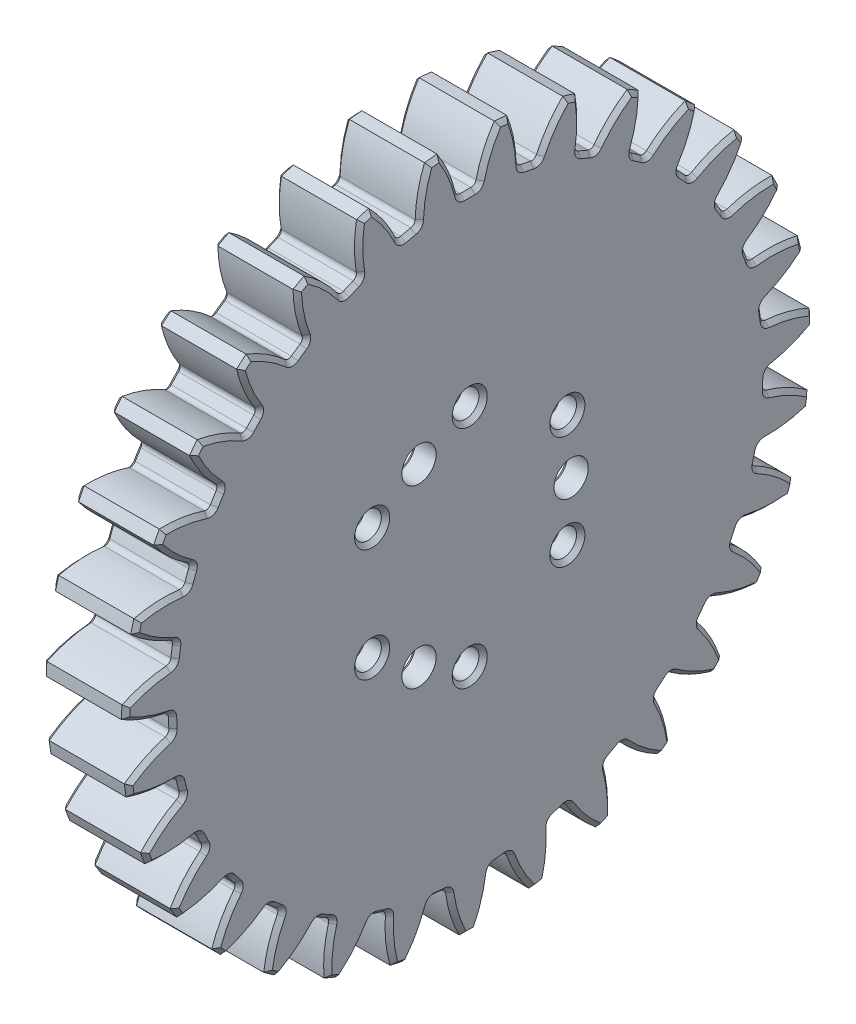
from build123d import *

# Parameters (mm, degrees)
BASPROSKE_W                = 10
BASPROSKE_H                = 41.25
TOOTHCUT_DEPTH             = 60.187203009
ROOTFILLETS_R              = 0.626
TEETHCUTS_COUNT            = 31
TEETHCUTS_ANGLE            = 348.387096774
ROOTFILLETS_OF_TEETHCUTS_R = 0.626
BORSKE_R                   = 25
BORE_DEPTH                 = 50.0000508
SKETCH_3_R                 = 25
SKETCH_3_R_2               = 24.65
EXTRUDE_1_DEPTH            = 10
SKETCH_4_R                 = 24.65
EXTRUDE_2_DEPTH            = 3
SKETCH_6_R                 = 29.5
CUT_EXTRUDE_4_DEPTH        = 7
SKETCH_5_R                 = 1.6
CUT_EXTRUDE_3_DEPTH        = 59.739545682
CHAMFER_1_SIZE             = 0.5
SKETCH_7_R                 = 2.05
CUT_EXTRUDE_5_DEPTH        = 59.739545612
CHAMFER_2_SIZE             = 0.5


with BuildPart() as part:
    # BasProSke → Base-Revolve (revolve)
    with BuildSketch(Plane(origin=(0, 0, 0), x_dir=(1, 0, 0), z_dir=(0, 1, 0)), mode=Mode.PRIVATE) as base_revolve_sk:
        with Locations((5, 20.625)):
            Rectangle(BASPROSKE_W, BASPROSKE_H)
    revolve(base_revolve_sk.sketch.rotate(Axis((-10, 0, 0), (1, 0, 0)), 180), axis=Axis((-10, 0, 0), (1, 0, 0)))

    # TooCutSke → ToothCut (cut, through all)
    with BuildSketch(Plane(origin=(0, 0, 0), x_dir=(0, 0, -1), z_dir=(1, 0, 0))):
        with BuildLine():
            ThreePointArc((1.147808078, 35.605503965), (0, 35.624), (-1.147808078, 35.605503965))
            ThreePointArc((-1.147808078, 35.605503965), (-2.025088466, 38.480305856), (-3.440714783, 41.131741112))
            ThreePointArc((-3.440714783, 41.131741112), (0, 41.2754), (3.440714783, 41.131741112))
            ThreePointArc((3.440714783, 41.131741112), (2.025088466, 38.480305856), (1.147808078, 35.605503965))
        make_face()
    toothcut = extrude(amount=TOOTHCUT_DEPTH, mode=Mode.SUBTRACT)

    # RootFillets
    rootfillets_edges = [part.edges().sort_by_distance(p)[0] for p in [
        (5, 35.605503965, -1.147808078),
        (5, 35.605503965, 1.147808078),
    ]]
    fillet(rootfillets_edges, radius=ROOTFILLETS_R)

    # TeethCuts: ToothCut ×31 about axis
    teethcuts_axis = Axis((-10, 0, 0), (1, 0, 0))
    for i in range(1, TEETHCUTS_COUNT):
        add(toothcut.rotate(teethcuts_axis, i * TEETHCUTS_ANGLE / (TEETHCUTS_COUNT - 1)), mode=Mode.SUBTRACT)

    # RootFillets of TeethCuts
    rootfillets_of_teethcuts_edges = [part.edges().sort_by_distance(p)[0] for p in [
        (5, 35.107709275, 6.043022876),
        (5, 34.64560514, 8.291647635),
        (5, 33.172600842, 12.986451763),
        (5, 32.267311169, 15.096026163),
        (5, 29.879402233, 19.398213789),
        (5, 28.567989688, 21.282371606),
        (5, 25.362937385, 25.015810664),
        (5, 23.699091353, 26.597414255),
        (5, 19.808110902, 29.609257311),
        (5, 17.859949433, 30.82355564),
        (5, 13.44233803, 32.990497485),
        (5, 11.289619084, 33.787777034),
        (5, 6.52623426, 35.021102815),
        (5, 4.257090404, 35.368722868),
        (5, -0.657054307, 35.617940081),
        (5, -2.949724057, 35.501669031),
        (5, -7.813442994, 34.756574696),
        (5, -10.035776469, 34.181172693),
        (5, -14.649948406, 32.472271059),
        (5, -16.710963013, 31.461295129),
        (5, -20.88668321, 28.858548829),
        (5, -22.702000768, 27.453388445),
        (5, -26.268314748, 24.063354219),
        (5, -27.763615944, 22.321536814),
        (5, -30.574518395, 18.283003061),
        (5, -31.688585421, 16.275838842),
        (5, -33.628997666, 11.754143609),
        (5, -34.316220488, 9.563806116),
        (5, -35.306701822, 4.744068136),
        (5, -35.538945456, 2.460230043),
        (5, -35.538945456, -2.460230043),
        (5, -35.306701822, -4.744068136),
        (5, -34.316220488, -9.563806116),
        (5, -33.628997666, -11.754143609),
        (5, -31.688585421, -16.275838842),
        (5, -30.574518395, -18.283003061),
        (5, -27.763615944, -22.321536814),
        (5, -26.268314748, -24.063354219),
        (5, -22.702000768, -27.453388445),
        (5, -20.88668321, -28.858548829),
        (5, -16.710963013, -31.461295129),
        (5, -14.649948406, -32.472271059),
        (5, -10.035776469, -34.181172693),
        (5, -7.813442994, -34.756574696),
        (5, -2.949724057, -35.501669031),
        (5, -0.657054307, -35.617940081),
        (5, 4.257090404, -35.368722868),
        (5, 6.52623426, -35.021102815),
        (5, 11.289619084, -33.787777034),
        (5, 13.44233803, -32.990497485),
        (5, 17.859949433, -30.82355564),
        (5, 19.808110902, -29.609257311),
        (5, 23.699091353, -26.597414255),
        (5, 25.362937385, -25.015810664),
        (5, 28.567989688, -21.282371606),
        (5, 29.879402233, -19.398213789),
        (5, 32.267311169, -15.096026163),
        (5, 33.172600842, -12.986451763),
        (5, 34.64560514, -8.291647635),
        (5, 35.107709275, -6.043022876),
    ]]
    fillet(rootfillets_of_teethcuts_edges, radius=ROOTFILLETS_OF_TEETHCUTS_R)

    # BorSke → Bore (cut, symmetric)
    with BuildSketch(Plane(origin=(0, 0, 0), x_dir=(0, 0, -1), z_dir=(1, 0, 0))):
        with Locations(Location((0, 0, 0), (0, 0, 180))):
            Circle(BORSKE_R)
    extrude(amount=BORE_DEPTH, both=True, mode=Mode.SUBTRACT)

    # 草图3 → 凸台-拉伸1 (add)
    with BuildSketch(Plane(origin=(10, 0, 0), x_dir=(0, 0, -1), z_dir=(1, 0, 0))):
        Circle(SKETCH_3_R)
        Circle(SKETCH_3_R_2, mode=Mode.SUBTRACT)
    extrude(amount=-EXTRUDE_1_DEPTH)

    # 草图4 → 凸台-拉伸2 (add)
    with BuildSketch(Plane(origin=(10, 0, 0), x_dir=(0, 0, -1), z_dir=(1, 0, 0))):
        Circle(SKETCH_4_R)
    extrude(amount=-EXTRUDE_2_DEPTH)

    # 草图6 → 切除-拉伸4 (cut)
    with BuildSketch(Plane.ZY):
        Circle(SKETCH_6_R)
    extrude(amount=-CUT_EXTRUDE_4_DEPTH, mode=Mode.SUBTRACT)

    # 草图5 → 切除-拉伸3 (cut, through all)
    with BuildSketch(Plane.ZY.offset(-7)):
        with Locations((0, 13.5)):
            Circle(SKETCH_5_R)
        with Locations((11.691342951, 6.75)):
            Circle(SKETCH_5_R)
        with Locations((11.691342951, -6.75)):
            Circle(SKETCH_5_R)
        with Locations((0, -13.5)):
            Circle(SKETCH_5_R)
        with Locations((-11.691342951, -6.75)):
            Circle(SKETCH_5_R)
        with Locations((-11.691342951, 6.75)):
            Circle(SKETCH_5_R)
    extrude(amount=-CUT_EXTRUDE_3_DEPTH, mode=Mode.SUBTRACT)

    # 倒角1
    chamfer_1_edges = [part.edges().sort_by_distance(p)[0] for p in [
        (0, 29.23887683, -20.350858895),
        (10, 29.23887683, -20.350858895),
        (0, 30.553578018, -23.846825759),
        (10, 30.553578018, -23.846825759),
        (0, 32.973829839, -20.369555082),
        (0, 28.75327951, -21.268959503),
        (10, 28.75327951, -21.268959503),
        (0, 29.931177133, -19.576627809),
        (10, 29.931177133, -19.576627809),
        (0, 32.736953081, -14.048532983),
        (10, 32.736953081, -14.048532983),
        (0, 34.728475215, -17.208289796),
        (10, 34.728475215, -17.208289796),
        (0, 36.399214898, -13.315005944),
        (0, 32.446108261, -15.045590039),
        (10, 32.446108261, -15.045590039),
        (0, 33.259230385, -13.150791426),
        (10, 33.259230385, -13.150791426),
        (0, 34.894774627, -7.17105848),
        (10, 34.894774627, -7.17105848),
        (0, 37.481584557, -9.865244427),
        (10, 37.481584557, -9.865244427),
        (0, 38.334411822, -5.715338899),
        (0, 34.810589527, -8.206252352),
        (10, 34.810589527, -8.206252352),
        (0, 35.225646837, -6.186560097),
        (10, 35.225646837, -6.186560097),
        (0, 0, -29.5),
        (10, 13.5, -1.6),
        (10, 6.75, -13.291342951),
        (10, -6.75, -13.291342951),
        (10, -13.5, -1.6),
        (10, -6.75, 10.091342951),
        (10, 6.75, 10.091342951),
        (10, 41.03835959, -4.173193282),
        (10, 39.358244327, -12.348728823),
        (10, 36.066797916, -20.018705954),
        (10, 31.298772561, -26.869114912),
        (10, 25.24937178, -32.619499149),
        (10, 18.166258752, -37.034437257),
        (10, 10.339416956, -39.933181153),
        (10, 2.089278215, -41.197055921),
        (10, -6.246395822, -40.774318379),
        (10, -14.32634168, -38.682275451),
        (10, -21.819765426, -35.006575622),
        (10, -28.419885412, -29.897702473),
        (10, -33.85649195, -23.564813873),
        (10, -37.907009729, -16.267179023),
        (10, -40.405610077, -8.303563954),
        (10, -41.25, 0),
        (10, -40.405610077, 8.303563954),
        (10, -37.907009729, 16.267179023),
        (10, -33.85649195, 23.564813873),
        (10, -28.419885412, 29.897702473),
        (10, -21.819765426, 35.006575622),
        (10, -14.32634168, 38.682275451),
        (10, -6.246395822, 40.774318379),
        (10, 2.089278215, 41.197055921),
        (10, 10.339416956, 39.933181153),
        (10, 18.166258752, 37.034437257),
        (10, 25.24937178, 32.619499149),
        (10, 31.298772561, 26.869114912),
        (10, 36.066797916, 20.018705954),
        (10, 39.358244327, 12.348728823),
        (10, 38.700193422, 2.118314792),
        (10, -4.075728581, 38.543231118),
        (10, 3.766397206, 38.574687045),
        (10, 11.454326249, 37.026890751),
        (10, 18.673313829, 33.9632092),
        (10, 30.553578018, 23.846825759),
        (10, 25.127813747, 29.509069873),
        (10, 34.728475215, 17.208289796),
        (10, -38.715941598, 1.807787225),
        (10, -37.559519106, 9.564243462),
        (0, 35.624, 0),
        (10, 35.624, 0),
        (10, -30.743898075, 23.600952516),
        (10, -34.865405489, 16.929138448),
        (0, 38.700193422, -2.118314792),
        (10, 38.700193422, -2.118314792),
        (10, -18.945171484, 33.812315891),
        (10, -25.363731861, 29.306540816),
        (0, 38.700193422, 2.118314792),
        (10, -11.750993561, 36.933810781),
        (0, 35.749921169, -1.030949729),
        (10, 35.749921169, -1.030949729),
        (10, -22.013507979, -31.899807131),
        (0, 35.749921169, 1.030949729),
        (10, 35.749921169, 1.030949729),
        (10, -27.984274144, -26.815529627),
        (10, -15.141506211, -35.678102783),
        (10, -7.649609399, -37.995732715),
        (10, -32.809360837, -20.633421189),
        (10, -36.291228443, -13.606578063),
        (10, -38.287328892, -6.022680033),
        (10, 38.334411822, -5.715338899),
        (10, 36.399214898, -13.315005944),
        (0, 41.03835959, 4.173193282),
        (10, 28.198492312, -26.590172241),
        (10, 32.973829839, -20.369555082),
        (10, 22.268705197, -31.722184624),
        (10, 41.03835959, 4.173193282),
        (10, 15.427234675, -35.555487042),
        (10, 7.954171352, -37.933143642),
        (10, 0.15546332, -38.757812885),
        (10, 37.481584557, 9.865244427),
        (0, 39.358244327, -12.348728823),
        (0, 36.066797916, -20.018705954),
        (0, 34.894774627, 7.17105848),
        (10, 34.894774627, 7.17105848),
        (0, 31.298772561, -26.869114912),
        (0, 38.334411822, 5.715338899),
        (10, 38.334411822, 5.715338899),
        (0, 37.481584557, 9.865244427),
        (0, 35.225646837, 6.186560097),
        (10, 35.225646837, 6.186560097),
        (0, 25.24937178, -32.619499149),
        (0, 34.810589527, 8.206252352),
        (10, 34.810589527, 8.206252352),
        (0, 18.166258752, -37.034437257),
        (0, 32.736953081, 14.048532983),
        (10, 32.736953081, 14.048532983),
        (0, 36.399214898, 13.315005944),
        (10, 36.399214898, 13.315005944),
        (0, 10.339416956, -39.933181153),
        (0, 34.728475215, 17.208289796),
        (0, 33.259230385, 13.150791426),
        (10, 33.259230385, 13.150791426),
        (0, 32.446108261, 15.045590039),
        (10, 32.446108261, 15.045590039),
        (0, 2.089278215, -41.197055921),
        (0, 29.23887683, 20.350858895),
        (10, 29.23887683, 20.350858895),
        (0, -6.246395822, -40.774318379),
        (0, 32.973829839, 20.369555082),
        (10, 32.973829839, 20.369555082),
        (0, 30.553578018, 23.846825759),
        (0, 29.931177133, 19.576627809),
        (10, 29.931177133, 19.576627809),
        (0, 28.75327951, 21.268959503),
        (10, 28.75327951, 21.268959503),
        (0, -14.32634168, -38.682275451),
        (0, 24.543757525, 25.820018252),
        (0, -21.819765426, -35.006575622),
        (10, 24.543757525, 25.820018252),
        (0, 28.198492312, 26.590172241),
        (10, 28.198492312, 26.590172241),
        (0, 25.127813747, 29.509069873),
        (0, 25.377737972, 25.200994749),
        (0, -28.419885412, -29.897702473),
        (10, 25.377737972, 25.200994749),
        (0, 23.883288117, 26.621575265),
        (10, 23.883288117, 26.621575265),
        (0, -33.85649195, -23.564813873),
        (0, 18.843813904, 30.232103029),
        (10, 18.843813904, 30.232103029),
        (0, 22.268705197, 31.722184624),
        (10, 22.268705197, 31.722184624),
        (0, -37.907009729, -16.267179023),
        (0, 18.673313829, 33.9632092),
        (0, 19.785331237, 29.793630003),
        (10, 19.785331237, 29.793630003),
        (0, 18.035512103, 30.884300609),
        (10, 18.035512103, 30.884300609),
        (0, -40.405610077, -8.303563954),
        (0, 12.372402327, 33.406481956),
        (10, 12.372402327, 33.406481956),
        (0, -41.25, 0),
        (0, 15.427234675, 35.555487042),
        (10, 15.427234675, 35.555487042),
        (0, 11.454326249, 37.026890751),
        (0, 13.382910717, 33.166510544),
        (10, 13.382910717, 33.166510544),
        (0, 11.449360104, 33.882619056),
        (10, 11.449360104, 33.882619056),
        (0, -40.405610077, 8.303563954),
        (0, -37.907009729, 16.267179023),
        (0, 5.394463146, 35.213195586),
        (10, 5.394463146, 35.213195586),
        (0, 7.954171352, 37.933143642),
        (10, 7.954171352, 37.933143642),
        (0, 3.766397206, 38.574687045),
        (0, -33.85649195, 23.564813873),
        (0, 6.432592259, 35.181550246),
        (10, 6.432592259, 35.181550246),
        (0, 4.394469958, 35.493779099),
        (10, 4.394469958, 35.493779099),
        (0, -28.419885412, 29.897702473),
        (0, -1.804325991, 35.578276851),
        (10, -1.804325991, 35.578276851),
        (0, 0.15546332, 38.757812885),
        (10, 0.15546332, 38.757812885),
        (0, -21.819765426, 35.006575622),
        (0, -4.075728581, 38.543231118),
        (0, -0.781077281, 35.756253148),
        (10, -0.781077281, 35.756253148),
        (0, -2.840330305, 35.651819654),
        (10, -2.840330305, 35.651819654),
        (0, -14.32634168, 38.682275451),
        (0, -8.929245809, 34.486779282),
        (10, -8.929245809, 34.486779282),
        (0, -6.246395822, 40.774318379),
        (0, -7.649609399, 37.995732715),
        (10, -7.649609399, 37.995732715),
        (0, -11.750993561, 36.933810781),
        (0, -7.962769426, 34.867090845),
        (10, -7.962769426, 34.867090845),
        (0, -9.958847112, 34.350270525),
        (0, 2.089278215, 41.197055921),
        (10, -9.958847112, 34.350270525),
        (0, 10.339416956, 39.933181153),
        (0, -15.688601255, 31.983388918),
        (10, -15.688601255, 31.983388918),
        (0, -15.141506211, 35.678102783),
        (10, -15.141506211, 35.678102783),
        (0, -18.945171484, 33.812315891),
        (0, 18.166258752, 37.034437257),
        (0, -14.818464855, 32.550465746),
        (10, -14.818464855, 32.550465746),
        (0, -16.669647548, 31.642417283),
        (10, -16.669647548, 31.642417283),
        (0, 25.24937178, 32.619499149),
        (0, -21.805663522, 28.170594853),
        (10, -21.805663522, 28.170594853),
        (0, 31.298772561, 26.869114912),
        (0, -22.013507979, 31.899807131),
        (10, -22.013507979, 31.899807131),
        (0, -25.363731861, 29.306540816),
        (0, -21.067490591, 28.901220754),
        (10, -21.067490591, 28.901220754),
        (0, -22.697990654, 27.639119761),
        (10, -22.697990654, 27.639119761),
        (0, 36.066797916, 20.018705954),
        (0, -27.029999363, 23.204493324),
        (0, 39.358244327, 12.348728823),
        (10, -27.029999363, 23.204493324),
        (0, -27.984274144, 26.815529627),
        (10, -27.984274144, 26.815529627),
        (0, -30.743898075, 23.600952516),
        (0, -26.454010788, 24.06875639),
        (10, -26.454010788, 24.06875639),
        (0, -27.797075357, 22.504273428),
        (10, -27.797075357, 22.504273428),
        (0, -31.147723854, 17.288397113),
        (10, -31.147723854, 17.288397113),
        (0, -32.809360837, 20.633421189),
        (10, -32.809360837, 20.633421189),
        (0, -34.865405489, 16.929138448),
        (0, -30.757500675, 18.25091431),
        (10, -30.757500675, 18.25091431),
        (0, -31.758144528, 16.448099497),
        (10, -31.758144528, 16.448099497),
        (0, -33.99025687, 10.664511893),
        (10, -33.99025687, 10.664511893),
        (0, -36.291228443, 13.606578063),
        (10, -36.291228443, 13.606578063),
        (0, -37.559519106, 9.564243462),
        (0, -33.80177487, 11.685877655),
        (10, -33.80177487, 11.685877655),
        (0, -34.419031531, 9.71853844),
        (10, -34.419031531, 9.71853844),
        (0, -35.441224777, 3.604020302),
        (10, -35.441224777, 3.604020302),
        (0, -38.287328892, 6.022680033),
        (10, -38.287328892, 6.022680033),
        (0, -38.715941598, 1.807787225),
        (0, -35.46220043, 4.642419795),
        (10, -35.46220043, 4.642419795),
        (0, -35.670799339, 2.591099277),
        (10, -35.670799339, 2.591099277),
        (0, -35.441224777, -3.604020302),
        (10, -35.441224777, -3.604020302),
        (0, -38.715941598, -1.807787225),
        (10, -38.715941598, -1.807787225),
        (0, -38.287328892, -6.022680033),
        (0, -35.670799339, -2.591099277),
        (10, -35.670799339, -2.591099277),
        (0, -35.46220043, -4.642419795),
        (10, -35.46220043, -4.642419795),
        (0, -33.99025687, -10.664511893),
        (10, -33.99025687, -10.664511893),
        (0, -37.559519106, -9.564243462),
        (10, -37.559519106, -9.564243462),
        (0, -36.291228443, -13.606578063),
        (0, -34.419031531, -9.71853844),
        (10, -34.419031531, -9.71853844),
        (0, -33.80177487, -11.685877655),
        (10, -33.80177487, -11.685877655),
        (0, -31.147723854, -17.288397113),
        (10, -31.147723854, -17.288397113),
        (0, -34.865405489, -16.929138448),
        (10, -34.865405489, -16.929138448),
        (0, -32.809360837, -20.633421189),
        (0, -31.758144528, -16.448099497),
        (10, -31.758144528, -16.448099497),
        (0, -30.757500675, -18.25091431),
        (10, -30.757500675, -18.25091431),
        (0, -27.029999363, -23.204493324),
        (10, -27.029999363, -23.204493324),
        (0, -30.743898075, -23.600952516),
        (10, -30.743898075, -23.600952516),
        (0, -27.984274144, -26.815529627),
        (0, -27.797075357, -22.504273428),
        (10, -27.797075357, -22.504273428),
        (0, -26.454010788, -24.06875639),
        (10, -26.454010788, -24.06875639),
        (0, -21.805663522, -28.170594853),
        (10, -21.805663522, -28.170594853),
        (0, -25.363731861, -29.306540816),
        (10, -25.363731861, -29.306540816),
        (0, -22.013507979, -31.899807131),
        (0, -22.697990654, -27.639119761),
        (10, -22.697990654, -27.639119761),
        (0, -21.067490591, -28.901220754),
        (10, -21.067490591, -28.901220754),
        (0, -15.688601255, -31.983388918),
        (10, -15.688601255, -31.983388918),
        (0, -18.945171484, -33.812315891),
        (10, -18.945171484, -33.812315891),
        (0, -15.141506211, -35.678102783),
        (0, -16.669647548, -31.642417283),
        (10, -16.669647548, -31.642417283),
        (0, -14.818464855, -32.550465746),
        (10, -14.818464855, -32.550465746),
        (0, -8.929245809, -34.486779282),
        (10, -8.929245809, -34.486779282),
        (0, -11.750993561, -36.933810781),
        (10, -11.750993561, -36.933810781),
        (0, -7.649609399, -37.995732715),
        (0, -9.958847112, -34.350270525),
        (10, -9.958847112, -34.350270525),
        (0, -7.962769426, -34.867090845),
        (10, -7.962769426, -34.867090845),
        (0, -1.804325991, -35.578276851),
        (10, -1.804325991, -35.578276851),
        (0, -4.075728581, -38.543231118),
        (10, -4.075728581, -38.543231118),
        (0, 0.15546332, -38.757812885),
        (0, -2.840330305, -35.651819654),
        (10, -2.840330305, -35.651819654),
        (0, 41.03835959, -4.173193282),
        (0, -0.781077281, -35.756253148),
        (10, -0.781077281, -35.756253148),
        (0, 5.394463146, -35.213195586),
        (10, 5.394463146, -35.213195586),
        (0, 3.766397206, -38.574687045),
        (10, 3.766397206, -38.574687045),
        (0, 7.954171352, -37.933143642),
        (0, 4.394469958, -35.493779099),
        (10, 4.394469958, -35.493779099),
        (0, 6.432592259, -35.181550246),
        (10, 6.432592259, -35.181550246),
        (0, 12.372402327, -33.406481956),
        (10, 12.372402327, -33.406481956),
        (0, 11.454326249, -37.026890751),
        (10, 11.454326249, -37.026890751),
        (0, 15.427234675, -35.555487042),
        (0, 11.449360104, -33.882619056),
        (10, 11.449360104, -33.882619056),
        (0, 13.382910717, -33.166510544),
        (10, 13.382910717, -33.166510544),
        (0, 18.843813904, -30.232103029),
        (10, 18.843813904, -30.232103029),
        (0, 18.673313829, -33.9632092),
        (10, 18.673313829, -33.9632092),
        (0, 22.268705197, -31.722184624),
        (0, 18.035512103, -30.884300609),
        (10, 18.035512103, -30.884300609),
        (0, 19.785331237, -29.793630003),
        (10, 19.785331237, -29.793630003),
        (0, 24.543757525, -25.820018252),
        (10, 24.543757525, -25.820018252),
        (0, 25.127813747, -29.509069873),
        (10, 25.127813747, -29.509069873),
        (0, 28.198492312, -26.590172241),
        (0, 23.883288117, -26.621575265),
        (10, 23.883288117, -26.621575265),
        (0, 25.377737972, -25.200994749),
        (10, 25.377737972, -25.200994749),
    ]]
    chamfer(chamfer_1_edges, length=CHAMFER_1_SIZE)

    # 草图7 → 切除-拉伸5 (cut, through all)
    with BuildSketch(Plane.ZY.offset(-7)):
        with Locations((6.075, 10.522208656)):
            Circle(SKETCH_7_R)
        with Locations((-12.15, 0)):
            Circle(SKETCH_7_R)
        with Locations((6.075, -10.522208656)):
            Circle(SKETCH_7_R)
    extrude(amount=-CUT_EXTRUDE_5_DEPTH, mode=Mode.SUBTRACT)

    # 倒角2
    chamfer_2_edges = [part.edges().sort_by_distance(p)[0] for p in [
        (7, 0, -29.5),
        (7, 13.5, -1.6),
        (7, 6.75, -13.291342951),
        (7, -6.75, -13.291342951),
        (7, -13.5, -1.6),
        (7, -6.75, 10.091342951),
        (7, 6.75, 10.091342951),
        (7, 10.522208656, 4.025),
        (7, 0, -14.2),
        (7, -10.522208656, 4.025),
    ]]
    chamfer(chamfer_2_edges, length=CHAMFER_2_SIZE)


solid = part.part
